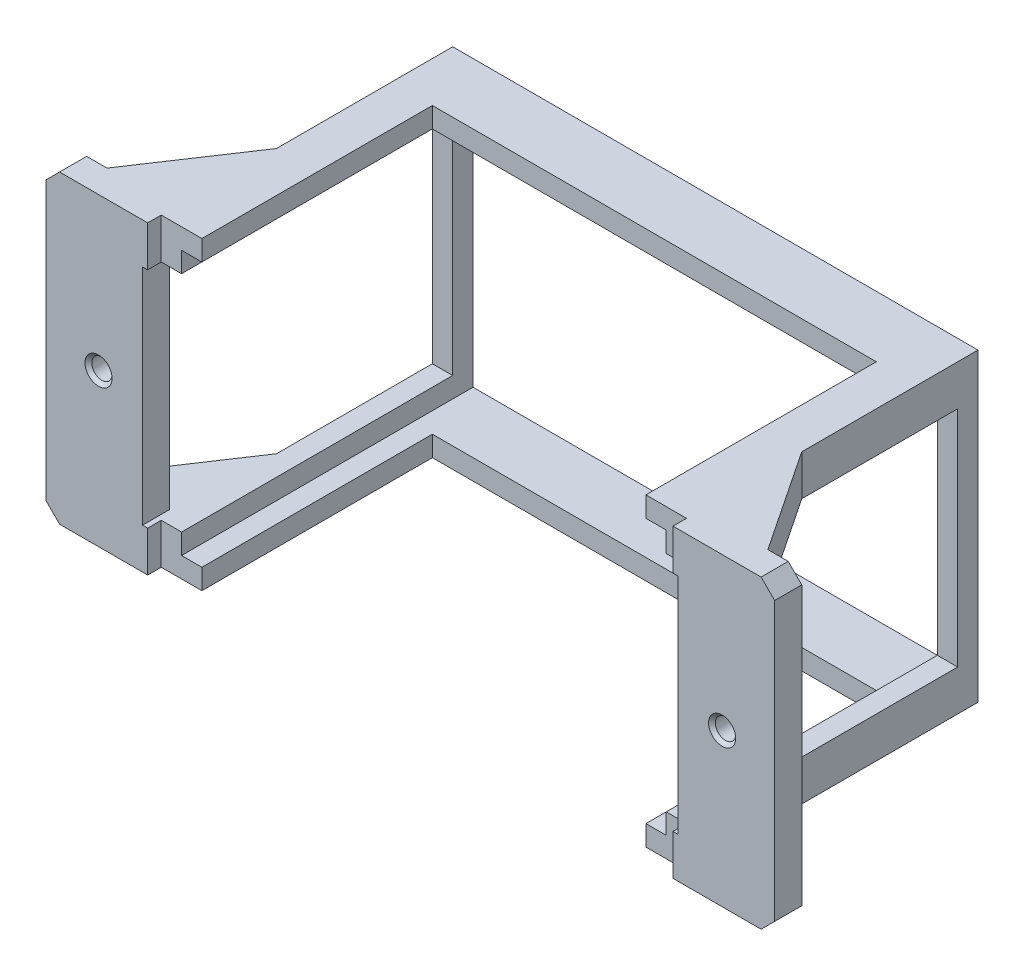
from build123d import *

# Parameters (mm, degrees)
SKETCH_1_W             = 77.5
SKETCH_1_H             = 45
SKETCH_1_W_2           = 71.5
SKETCH_1_H_2           = 39
EXTRUDE_1_DEPTH        = 3
SKETCH_2_W             = 3
SKETCH_2_H             = 3
EXTRUDE_2_DEPTH        = 40
SKETCH_3_W             = 3
SKETCH_3_H             = 3
EXTRUDE_3_DEPTH        = 40
EXTRUDE_4_DEPTH        = 2
EXTRUDE_4_DEPTH_BACK   = 2
EXTRUDE_4_2_DEPTH      = 2
EXTRUDE_4_2_DEPTH_BACK = 2
SKETCH_5_W             = 65.5
SKETCH_5_H             = 6
EXTRUDE_5_DEPTH        = 3
SKETCH_6_W             = 65.5
SKETCH_6_H             = 6
EXTRUDE_6_DEPTH        = 3
SKETCH_7_R             = 1.5
CUT_EXTRUDE_1_DEPTH    = 5
CHAMFER_1_SIZE         = 0.5
CHAMFER_2_SIZE         = 0.5
CHAMFER_3_SIZE         = 2
CHAMFER_4_SIZE         = 2
EXTRUDE_7_DEPTH        = 6
MIRROR_2_COPY_1_DEPTH  = 6
MIRROR_2_COPY_2_DEPTH  = 6


with BuildPart() as part:
    # 草图1 → 凸台-拉伸1 (new body)
    with BuildSketch(Plane.XY):
        Rectangle(SKETCH_1_W, SKETCH_1_H)
        Rectangle(SKETCH_1_W_2, SKETCH_1_H_2, mode=Mode.SUBTRACT)
    extrude(amount=EXTRUDE_1_DEPTH)

    # 草图2 → 凸台-拉伸2 (add)
    with BuildSketch(Plane.XY.offset(3)):
        with Locations((37.25, 21)):
            Rectangle(SKETCH_2_W, SKETCH_2_H)
        with Locations((-37.25, 21)):
            Rectangle(SKETCH_2_W, SKETCH_2_H)
        with Locations((-37.25, -21)):
            Rectangle(SKETCH_2_W, SKETCH_2_H)
        with Locations((37.25, -21)):
            Rectangle(SKETCH_2_W, SKETCH_2_H)
    extrude(amount=EXTRUDE_2_DEPTH)

    # 草图3 → 凸台-拉伸3 (add)
    with BuildSketch(Plane.XY.offset(3)):
        with Locations((34.25, -21)):
            Rectangle(SKETCH_3_W, SKETCH_3_H)
        with Locations((37.25, 18)):
            Rectangle(SKETCH_3_W, SKETCH_3_H)
        with Locations((34.25, 21)):
            Rectangle(SKETCH_3_W, SKETCH_3_H)
        with Locations((37.25, -18)):
            Rectangle(SKETCH_3_W, SKETCH_3_H)
        with Locations((-34.25, 21)):
            Rectangle(SKETCH_3_W, SKETCH_3_H)
        with Locations((-37.25, 18)):
            Rectangle(SKETCH_3_W, SKETCH_3_H)
        with Locations((-37.25, -18)):
            Rectangle(SKETCH_3_W, SKETCH_3_H)
        with Locations((-34.25, -21)):
            Rectangle(SKETCH_3_W, SKETCH_3_H)
    extrude(amount=EXTRUDE_3_DEPTH)

    # 草图5 → 凸台-拉伸5 (add)
    with BuildSketch(Plane(origin=(0, 22.5, 0), x_dir=(1, 0, 0), z_dir=(0, 1, 0))):
        with Locations((0, -6)):
            Rectangle(SKETCH_5_W, SKETCH_5_H)
    extrude(amount=-EXTRUDE_5_DEPTH)


with BuildPart() as body_2:
    # 草图4 → 凸台-拉伸4 (new, two sides: drawn at the far end of the back side and taken through both)
    with BuildSketch(Plane.XY.offset(43).offset(-EXTRUDE_4_DEPTH_BACK)):
        Polygon((38.75, 22.5), (53.75, 22.5), (53.75, -22.5), (38.75, -22.5), (38.75, -16.5), (39.5, -16.5), (39.5, 16.5), (38.75, 16.5), align=None)
    extrude(amount=EXTRUDE_4_DEPTH + EXTRUDE_4_DEPTH_BACK)


with BuildPart() as body_3:
    # 草图4 → Extrude 4 2 (new, two sides: drawn at the far end of the back side and taken through both)
    with BuildSketch(Plane.XY.offset(43).offset(-EXTRUDE_4_2_DEPTH_BACK)):
        Polygon((-38.75, -16.5), (-38.75, -22.5), (-53.75, -22.5), (-53.75, 22.5), (-38.75, 22.5), (-38.75, 16.5), (-39.5, 16.5), (-39.5, -16.5), align=None)
    extrude(amount=EXTRUDE_4_2_DEPTH + EXTRUDE_4_2_DEPTH_BACK)


with BuildPart() as body_4:
    # 草图6 → 凸台-拉伸6 (new body)
    with BuildSketch(Plane.XZ.offset(22.5)):
        with Locations((0, 6)):
            Rectangle(SKETCH_6_W, SKETCH_6_H)
    extrude(amount=-EXTRUDE_6_DEPTH)


with BuildPart() as cut_extrude_1_tool:
    # 草图7 → 切除-拉伸1 (new body)
    with BuildSketch(Plane.XY.offset(45)):
        with Locations((-46, 0)):
            Circle(SKETCH_7_R)
        with Locations((46, 0)):
            Circle(SKETCH_7_R)
    extrude(amount=-CUT_EXTRUDE_1_DEPTH)


with BuildPart() as body_2_1:
    add(body_2.part)

    # 切除-拉伸1: cut by cut_extrude_1_tool
    add(cut_extrude_1_tool.part, mode=Mode.SUBTRACT)

    # 倒角2
    chamfer_2_edges = [body_2_1.edges().sort_by_distance(p)[0] for p in [
        (44.5, 0, 45),
    ]]
    chamfer(chamfer_2_edges, length=CHAMFER_2_SIZE)

    # 倒角3
    chamfer_3_edges = [body_2_1.edges().sort_by_distance(p)[0] for p in [
        (53.75, -22.5, 43),
        (53.75, 22.5, 43),
    ]]
    chamfer(chamfer_3_edges, length=CHAMFER_3_SIZE)


with BuildPart() as body_3_1:
    add(body_3.part)

    # 切除-拉伸1: cut by cut_extrude_1_tool
    add(cut_extrude_1_tool.part, mode=Mode.SUBTRACT)

    # 倒角1
    chamfer_1_edges = [body_3_1.edges().sort_by_distance(p)[0] for p in [
        (-47.5, 0, 45),
    ]]
    chamfer(chamfer_1_edges, length=CHAMFER_1_SIZE)


with BuildPart() as part_1:
    add(part.part)

    # Combine 1: union body 3
    add(body_3_1.part)


with BuildPart() as body_4_1:
    add(body_4.part)

    # Combine 2: union part
    add(part_1.part)


with BuildPart() as body_2_2:
    add(body_2_1.part)

    # Combine 3: union body 4
    add(body_4_1.part)

    # 倒角4
    chamfer_4_edges = [body_2_2.edges().sort_by_distance(p)[0] for p in [
        (-53.75, -22.5, 43),
        (-53.75, 22.5, 43),
    ]]
    chamfer(chamfer_4_edges, length=CHAMFER_4_SIZE)

    # 草图8 → 凸台-拉伸7 (add)
    with BuildSketch(Plane(origin=(0, 22.5, 0), x_dir=(1, 0, 0), z_dir=(0, 1, 0))):
        Polygon((48.75, -41), (38.75, -26), (38.75, -41), align=None)
    extrude_7 = extrude(amount=-EXTRUDE_7_DEPTH)

    # 镜向1: 凸台-拉伸7 across plane
    add(extrude_7.mirror(Plane(origin=(0, 0, 0), x_dir=(0, 0, 1), z_dir=(1, 0, 0))))

    # 镜向2 copy 1 sketch → 镜向2 copy 1 (add)
    with BuildSketch(Plane(origin=(0, -22.5, 0), x_dir=(-1, 0, 0), z_dir=(0, -1, 0))):
        Polygon((48.75, -41), (38.75, -26), (38.75, -41), align=None)
    extrude(amount=-MIRROR_2_COPY_1_DEPTH)

    # 镜向2 copy 2 sketch → 镜向2 copy 2 (add)
    with BuildSketch(Plane.XZ.offset(22.5)):
        Polygon((48.75, 41), (38.75, 26), (38.75, 41), align=None)
    extrude(amount=-MIRROR_2_COPY_2_DEPTH)


solid = body_2_2.part
